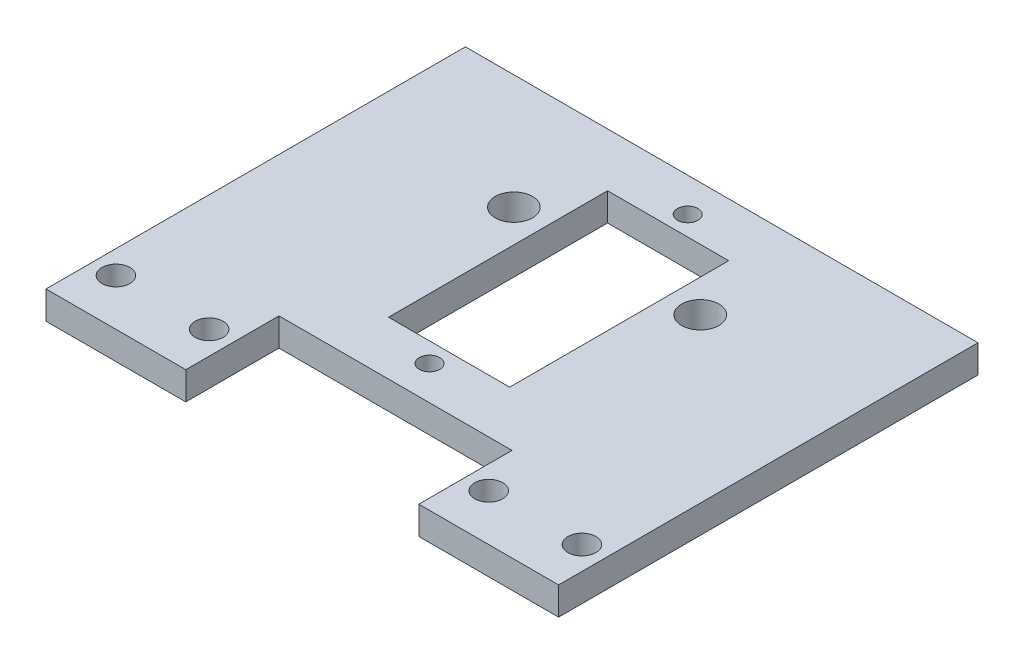
from build123d import *

# Parameters (mm, degrees)
SKETCH1_R           = 1.5
SKETCH1_R_2         = 1.1
SKETCH1_W           = 13
SKETCH1_H           = 23.5
BOSS_EXTRUDE1_DEPTH = 3
SKETCH2_R           = 2
CUT_EXTRUDE1_DEPTH  = 72.126647608


with BuildPart() as part:
    # Sketch1 → Boss-Extrude1 (new body)
    with BuildSketch(Plane(origin=(0, 0, 0), x_dir=(1, 0, 0), z_dir=(0, 1, 0))):
        Polygon((0, 0), (15, 0), (15, 10), (40, 10), (40, 0), (55, 0), (55, 45), (0, 45), align=None)
        with Locations((42.5, 5)):
            Circle(SKETCH1_R, mode=Mode.SUBTRACT)
        with Locations((52.5, 5)):
            Circle(SKETCH1_R, mode=Mode.SUBTRACT)
        with Locations((12.5, 5)):
            Circle(SKETCH1_R, mode=Mode.SUBTRACT)
        with Locations((2.5, 5)):
            Circle(SKETCH1_R, mode=Mode.SUBTRACT)
        with Locations((27.5, 41.35)):
            Circle(SKETCH1_R_2, mode=Mode.SUBTRACT)
        with Locations((27.5, 13.65)):
            Circle(SKETCH1_R_2, mode=Mode.SUBTRACT)
        with Locations((27.5, 27.5)):
            Rectangle(SKETCH1_W, SKETCH1_H, mode=Mode.SUBTRACT)
    extrude(amount=BOSS_EXTRUDE1_DEPTH)

    # Sketch2 → Cut-Extrude1 (cut, through all)
    with BuildSketch(Plane(origin=(0, 3, 0), x_dir=(1, 0, 0), z_dir=(0, 1, 0))):
        with Locations((17.5, 32.699969783)):
            Circle(SKETCH2_R)
        with Locations((37.5, 32.699969783)):
            Circle(SKETCH2_R)
    extrude(amount=-CUT_EXTRUDE1_DEPTH, mode=Mode.SUBTRACT)


solid = part.part
